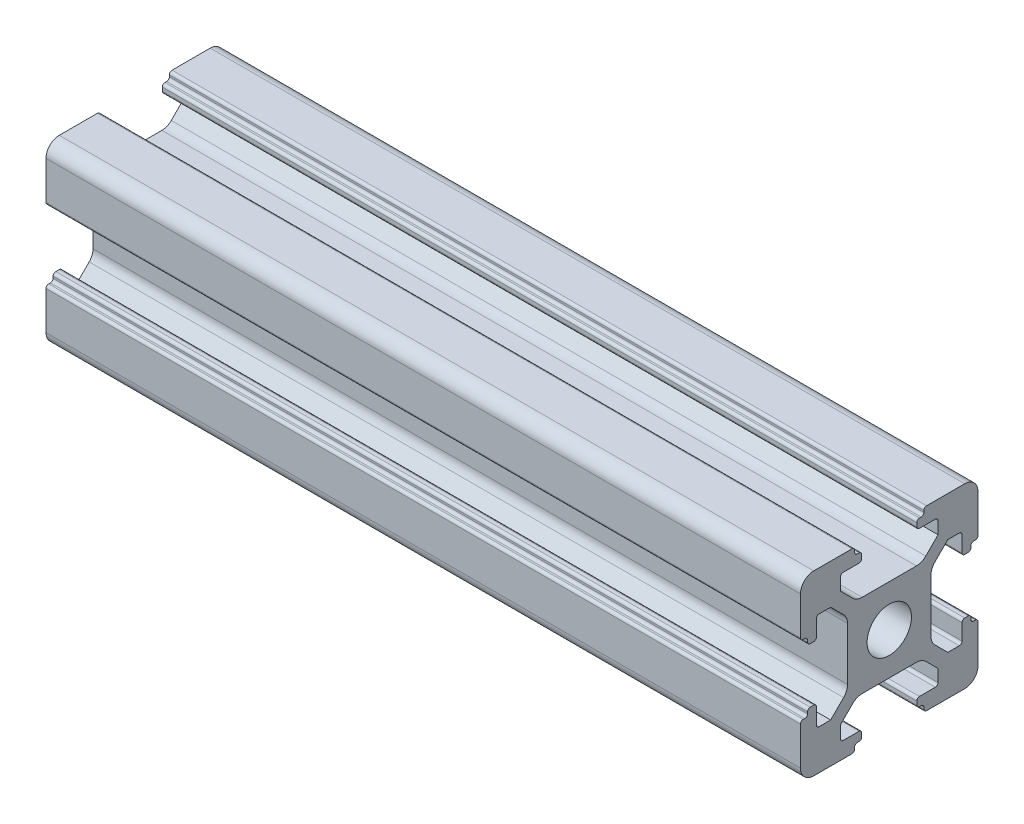
from build123d import *

# Parameters (mm, degrees)
SKETCH1_R           = 2.5
BOSS_EXTRUDE2_DEPTH = 42.5


with BuildPart() as part:
    # Sketch1 → Boss-Extrude2 (new, symmetric)
    with BuildSketch(Plane(origin=(0, 0, 0), x_dir=(0, 0, -1), z_dir=(1, 0, 0))):
        with BuildLine():
            Line((10, 4.2), (10, 8.5))
            ThreePointArc((10, 8.5), (9.560660172, 9.560660172), (8.5, 10))
            Line((8.5, 10), (4.2, 10))
            ThreePointArc((4.2, 10), (3.987867966, 9.912132034), (3.9, 9.7))
            Line((3.9, 9.7), (3.9, 9.5))
            ThreePointArc((3.9, 9.5), (3.812132034, 9.287867966), (3.6, 9.2))
            Line((3.6, 9.2), (3.4, 9.2))
            ThreePointArc((3.4, 9.2), (3.187867966, 9.112132034), (3.1, 8.9))
            Line((3.1, 8.9), (3.1, 8.5))
            ThreePointArc((3.1, 8.5), (3.187867966, 8.287867966), (3.4, 8.2))
            Line((3.4, 8.2), (5.2, 8.2))
            ThreePointArc((5.2, 8.2), (5.412132034, 8.112132034), (5.5, 7.9))
            Line((5.5, 7.9), (5.5, 6.521320344))
            Line((5.5, 6.521320344), (4.118019485, 5.139339828))
            ThreePointArc((4.118019485, 5.139339828), (3.631384461, 4.814180701), (3.057359313, 4.7))
            Line((3.057359313, 4.7), (-3.057359313, 4.7))
            ThreePointArc((-3.057359313, 4.7), (-3.631384461, 4.814180701), (-4.118019485, 5.139339828))
            Line((-4.118019485, 5.139339828), (-5.5, 6.521320344))
            Line((-5.5, 6.521320344), (-5.5, 7.9))
            ThreePointArc((-5.5, 7.9), (-5.412132034, 8.112132034), (-5.2, 8.2))
            Line((-5.2, 8.2), (-3.4, 8.2))
            ThreePointArc((-3.4, 8.2), (-3.187867966, 8.287867966), (-3.1, 8.5))
            Line((-3.1, 8.5), (-3.1, 8.9))
            ThreePointArc((-3.1, 8.9), (-3.187867966, 9.112132034), (-3.4, 9.2))
            Line((-3.4, 9.2), (-3.6, 9.2))
            ThreePointArc((-3.6, 9.2), (-3.812132034, 9.287867966), (-3.9, 9.5))
            Line((-3.9, 9.5), (-3.9, 9.7))
            ThreePointArc((-3.9, 9.7), (-3.987867966, 9.912132034), (-4.2, 10))
            Line((-4.2, 10), (-8.5, 10))
            ThreePointArc((-8.5, 10), (-9.560660172, 9.560660172), (-10, 8.5))
            Line((-10, 8.5), (-10, 4.2))
            ThreePointArc((-10, 4.2), (-9.912132034, 3.987867966), (-9.7, 3.9))
            Line((-9.7, 3.9), (-9.5, 3.9))
            ThreePointArc((-9.5, 3.9), (-9.287867966, 3.812132034), (-9.2, 3.6))
            Line((-9.2, 3.6), (-9.2, 3.4))
            ThreePointArc((-9.2, 3.4), (-9.112132034, 3.187867966), (-8.9, 3.1))
            Line((-8.9, 3.1), (-8.5, 3.1))
            ThreePointArc((-8.5, 3.1), (-8.287867966, 3.187867966), (-8.2, 3.4))
            Line((-8.2, 3.4), (-8.2, 5.2))
            ThreePointArc((-8.2, 5.2), (-8.112132034, 5.412132034), (-7.9, 5.5))
            Line((-7.9, 5.5), (-6.6, 5.5))
            Line((-6.6, 5.5), (-5.139339828, 4.039339828))
            ThreePointArc((-5.139339828, 4.039339828), (-4.814180701, 3.552704805), (-4.7, 2.978679656))
            Line((-4.7, 2.978679656), (-4.7, -2.978679656))
            ThreePointArc((-4.7, -2.978679656), (-4.814180701, -3.552704805), (-5.139339828, -4.039339828))
            Line((-5.139339828, -4.039339828), (-6.6, -5.5))
            Line((-6.6, -5.5), (-7.9, -5.5))
            ThreePointArc((-7.9, -5.5), (-8.112132034, -5.412132034), (-8.2, -5.2))
            Line((-8.2, -5.2), (-8.2, -3.4))
            ThreePointArc((-8.2, -3.4), (-8.287867966, -3.187867966), (-8.5, -3.1))
            Line((-8.5, -3.1), (-8.9, -3.1))
            ThreePointArc((-8.9, -3.1), (-9.112132034, -3.187867966), (-9.2, -3.4))
            Line((-9.2, -3.4), (-9.2, -3.6))
            ThreePointArc((-9.2, -3.6), (-9.287867966, -3.812132034), (-9.5, -3.9))
            Line((-9.5, -3.9), (-9.7, -3.9))
            ThreePointArc((-9.7, -3.9), (-9.912132034, -3.987867966), (-10, -4.2))
            Line((-10, -4.2), (-10, -8.5))
            ThreePointArc((-10, -8.5), (-9.560660172, -9.560660172), (-8.5, -10))
            Line((-8.5, -10), (-4.2, -10))
            ThreePointArc((-4.2, -10), (-3.987867966, -9.912132034), (-3.9, -9.7))
            Line((-3.9, -9.7), (-3.9, -9.5))
            ThreePointArc((-3.9, -9.5), (-3.812132034, -9.287867966), (-3.6, -9.2))
            Line((-3.6, -9.2), (-3.4, -9.2))
            ThreePointArc((-3.4, -9.2), (-3.187867966, -9.112132034), (-3.1, -8.9))
            Line((-3.1, -8.9), (-3.1, -8.5))
            ThreePointArc((-3.1, -8.5), (-3.187867966, -8.287867966), (-3.4, -8.2))
            Line((-3.4, -8.2), (-5.2, -8.2))
            ThreePointArc((-5.2, -8.2), (-5.412132034, -8.112132034), (-5.5, -7.9))
            Line((-5.5, -7.9), (-5.5, -6.521320344))
            Line((-5.5, -6.521320344), (-4.118019485, -5.139339828))
            ThreePointArc((-4.118019485, -5.139339828), (-3.631384461, -4.814180701), (-3.057359313, -4.7))
            Line((-3.057359313, -4.7), (3.057359313, -4.7))
            ThreePointArc((3.057359313, -4.7), (3.631384461, -4.814180701), (4.118019485, -5.139339828))
            Line((4.118019485, -5.139339828), (5.5, -6.521320344))
            Line((5.5, -6.521320344), (5.5, -7.9))
            ThreePointArc((5.5, -7.9), (5.412132034, -8.112132034), (5.2, -8.2))
            Line((5.2, -8.2), (3.4, -8.2))
            ThreePointArc((3.4, -8.2), (3.187867966, -8.287867966), (3.1, -8.5))
            Line((3.1, -8.5), (3.1, -8.9))
            ThreePointArc((3.1, -8.9), (3.187867966, -9.112132034), (3.4, -9.2))
            Line((3.4, -9.2), (3.6, -9.2))
            ThreePointArc((3.6, -9.2), (3.812132034, -9.287867966), (3.9, -9.5))
            Line((3.9, -9.5), (3.9, -9.7))
            ThreePointArc((3.9, -9.7), (3.987867966, -9.912132034), (4.2, -10))
            Line((4.2, -10), (8.5, -10))
            ThreePointArc((8.5, -10), (9.560660172, -9.560660172), (10, -8.5))
            Line((10, -8.5), (10, -4.2))
            ThreePointArc((10, -4.2), (9.912132034, -3.987867966), (9.7, -3.9))
            Line((9.7, -3.9), (9.5, -3.9))
            ThreePointArc((9.5, -3.9), (9.287867966, -3.812132034), (9.2, -3.6))
            Line((9.2, -3.6), (9.2, -3.4))
            ThreePointArc((9.2, -3.4), (9.112132034, -3.187867966), (8.9, -3.1))
            Line((8.9, -3.1), (8.5, -3.1))
            ThreePointArc((8.5, -3.1), (8.287867966, -3.187867966), (8.2, -3.4))
            Line((8.2, -3.4), (8.2, -5.2))
            ThreePointArc((8.2, -5.2), (8.112132034, -5.412132034), (7.9, -5.5))
            Line((7.9, -5.5), (6.6, -5.5))
            Line((6.6, -5.5), (5.139339828, -4.039339828))
            ThreePointArc((5.139339828, -4.039339828), (4.814180701, -3.552704805), (4.7, -2.978679656))
            Line((4.7, -2.978679656), (4.7, 2.978679656))
            ThreePointArc((4.7, 2.978679656), (4.814180701, 3.552704805), (5.139339828, 4.039339828))
            Line((5.139339828, 4.039339828), (6.6, 5.5))
            Line((6.6, 5.5), (7.9, 5.5))
            ThreePointArc((7.9, 5.5), (8.112132034, 5.412132034), (8.2, 5.2))
            Line((8.2, 5.2), (8.2, 3.4))
            ThreePointArc((8.2, 3.4), (8.287867966, 3.187867966), (8.5, 3.1))
            Line((8.5, 3.1), (8.9, 3.1))
            ThreePointArc((8.9, 3.1), (9.112132034, 3.187867966), (9.2, 3.4))
            Line((9.2, 3.4), (9.2, 3.6))
            ThreePointArc((9.2, 3.6), (9.287867966, 3.812132034), (9.5, 3.9))
            Line((9.5, 3.9), (9.7, 3.9))
            ThreePointArc((9.7, 3.9), (9.912132034, 3.987867966), (10, 4.2))
        make_face()
        Circle(SKETCH1_R, mode=Mode.SUBTRACT)
    extrude(amount=BOSS_EXTRUDE2_DEPTH, both=True)


solid = part.part
